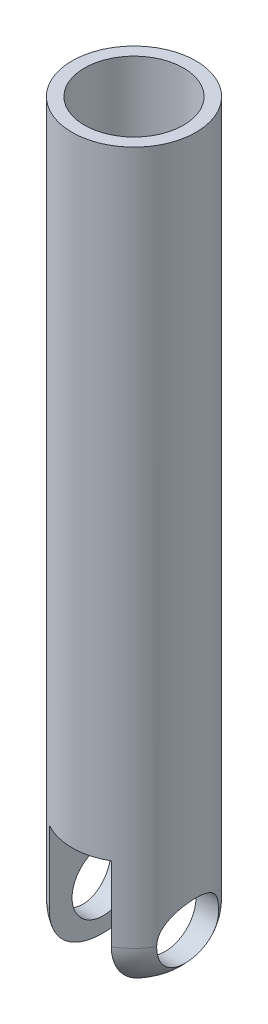
from build123d import *
from build123d.topology import SkipClean

# Parameters (mm, degrees)
SKETCH1_R               = 5
BOSS_EXTRUDE1_DEPTH     = 50
CUT_EXTRUDE1_START      = 4
SKETCH1_3_R             = 4
CUT_EXTRUDE1_DEPTH      = 50
BOSS_EXTRUDE2_START     = 10
BOSS_EXTRUDE2_DEPTH     = 10
FILLET3_R               = 4
CUT_EXTRUDE2_DEPTH      = 51.806003597
CUT_EXTRUDE2_DEPTH_BACK = 51.806003597
SKETCH3_R               = 2.5


with BuildPart() as part:
    # Sketch1 → Boss-Extrude1 (new body)
    with BuildSketch(Plane(origin=(0, 0, 0), x_dir=(1, 0, 0), z_dir=(0, 1, 0))):
        with Locations(Location((0, 0, 0), (0, 0, 270))):
            Circle(SKETCH1_R)
    extrude(amount=BOSS_EXTRUDE1_DEPTH)

    # Sketch1<3> → Cut-Extrude1 (cut)
    with BuildSketch(Plane(origin=(0, 0, 0), x_dir=(1, 0, 0), z_dir=(0, 1, 0)).offset(CUT_EXTRUDE1_START)):
        with Locations(Location((0, 0, 0), (0, 0, 270))):
            Circle(SKETCH1_3_R)
    extrude(amount=CUT_EXTRUDE1_DEPTH, mode=Mode.SUBTRACT)

    # Sketch2 → Boss-Extrude2 (add)
    with SkipClean():  # the faces are left unmerged after this step: merging them gives an invalid solid
        with BuildSketch(Plane.XZ.offset(BOSS_EXTRUDE2_START)):
            with BuildLine():
                Line((-2.5, 4.330127019), (-2.5, -4.330127019))
                ThreePointArc((-2.5, -4.330127019), (-5, 0), (-2.5, 4.330127019))
            make_face()
            with BuildLine():
                Line((2.5, 4.330127019), (2.5, -4.330127019))
                ThreePointArc((2.5, -4.330127019), (5, 0), (2.5, 4.330127019))
            make_face()
        extrude(amount=-BOSS_EXTRUDE2_DEPTH)

    # Fillet3
    # the kernel refuses this fillet: 4 mm, written as the material it takes off along each edge
    with BuildSketch(Plane(origin=(0, -10, 0), x_dir=(0.9956817269656716, 0, -0.09283263750781805), z_dir=(0.09283263750781805, 0, 0.9956817269656716))) as fillet3_piece_1:
        with BuildLine():
            CenterArc((5 - FILLET3_R, FILLET3_R), FILLET3_R, 270, 90)
            Line((5 - FILLET3_R, 0), (5, 0))
            Line((5, 0), (5, FILLET3_R))
        make_face()
    revolve(axis=Axis((0, -10, 0), (0, 1, 0)), revolution_arc=349.34682448, mode=Mode.SUBTRACT)
    with BuildSketch(Plane(origin=(0, -10, 0), x_dir=(-0.9956817269656714, 0, -0.09283263750781937), z_dir=(-0.09283263750781937, 0, 0.9956817269656714))) as fillet3_piece_2:
        with BuildLine():
            CenterArc((5 - FILLET3_R, -FILLET3_R), FILLET3_R, 0, 90)
            Line((5 - FILLET3_R, 0), (5, 0))
            Line((5, 0), (5, -FILLET3_R))
        make_face()
    revolve(axis=Axis((0, -10, 0), (0, -1, 0)), revolution_arc=349.34682448, mode=Mode.SUBTRACT)

    # Sketch3 → Cut-Extrude2 (cut, two sides: drawn at the far end of the back side and taken through both)
    with BuildSketch(Plane(origin=(-2.5, 0, 0), x_dir=(0, 0, -1), z_dir=(1, 0, 0)).offset(-CUT_EXTRUDE2_DEPTH_BACK)):
        with Locations((0, -6)):
            Circle(SKETCH3_R)
    extrude(amount=CUT_EXTRUDE2_DEPTH + CUT_EXTRUDE2_DEPTH_BACK, mode=Mode.SUBTRACT)


solid = part.part
